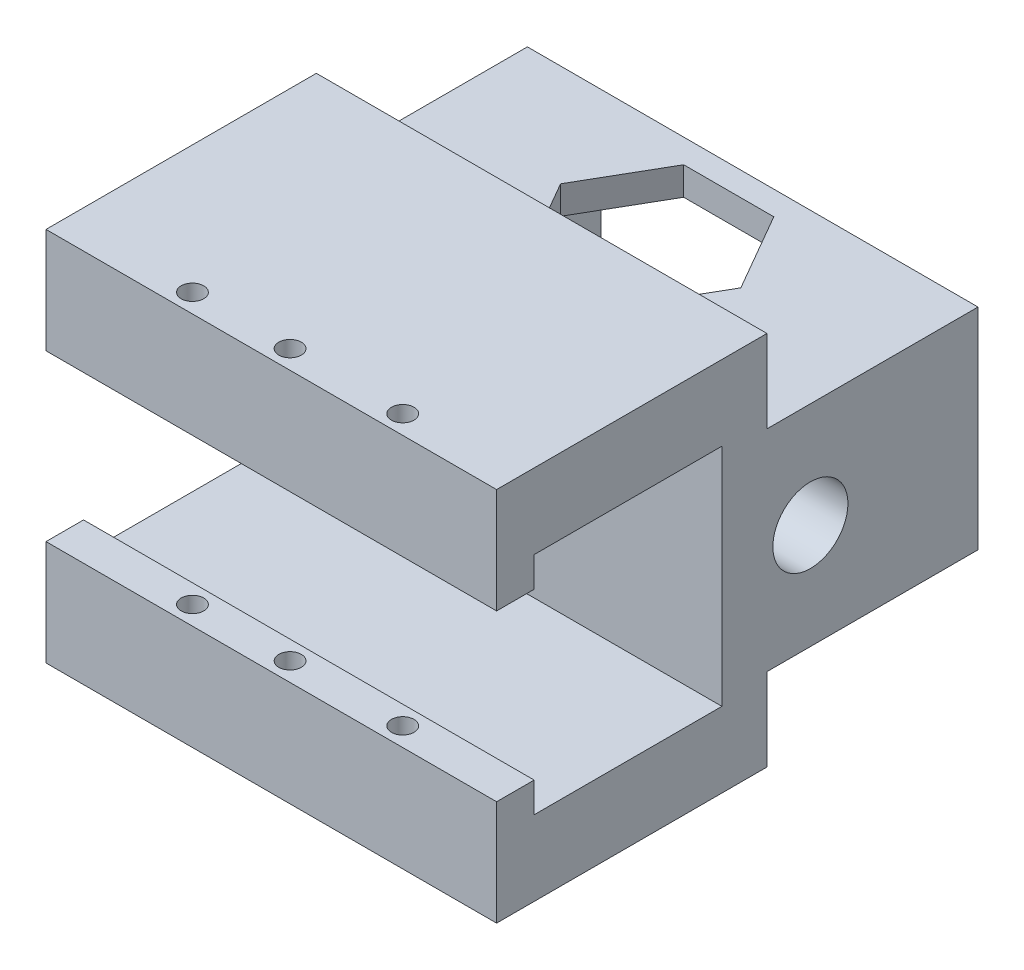
from build123d import *

# Parameters (mm, degrees)
SKETCH_1_W          = 60
SKETCH_1_H          = 50
EXTRUDE_1_DEPTH     = 6
SKETCH_2_W          = 60
SKETCH_2_H          = 10
EXTRUDE_3_DEPTH     = 30
SKETCH_3_W          = 60
SKETCH_3_H          = 5
EXTRUDE_4_DEPTH     = 4
SKETCH_4_W          = 60
SKETCH_4_H          = 5
EXTRUDE_5_DEPTH     = 4
SKETCH_9_W          = 60
SKETCH_9_H          = 28
SKETCH_9_W_2        = 40.4
SKETCH_9_H_2        = 20.5
EXTRUDE_6_DEPTH     = 28.1
SKETCH_11_R         = 5
CUT_EXTRUDE_3_DEPTH = 10
SKETCH_12_R         = 2.25
CUT_EXTRUDE_4_DEPTH = 16
CUT_EXTRUDE_5_DEPTH = 61.967204299
SKETCH_15_R         = 1.5
CUT_EXTRUDE_6_DEPTH = 60.093146811
SKETCH_16_R         = 1.5
CUT_EXTRUDE_7_DEPTH = 60.093146811


with BuildPart() as part:
    # 草图1 → 凸台-拉伸1 (new body)
    with BuildSketch(Plane.XY):
        Rectangle(SKETCH_1_W, SKETCH_1_H)
    extrude(amount=EXTRUDE_1_DEPTH)

    # 草图2 → 凸台-拉伸3 (add)
    with BuildSketch(Plane.XY.offset(6)):
        with Locations((0, 20)):
            Rectangle(SKETCH_2_W, SKETCH_2_H)
        with Locations((0, -20)):
            Rectangle(SKETCH_2_W, SKETCH_2_H)
    extrude(amount=EXTRUDE_3_DEPTH)

    # 草图3 → 凸台-拉伸4 (add)
    with BuildSketch(Plane(origin=(0, -15, 0), x_dir=(1, 0, 0), z_dir=(0, 1, 0))):
        with Locations((0, -33.5)):
            Rectangle(SKETCH_3_W, SKETCH_3_H)
    extrude(amount=EXTRUDE_4_DEPTH)

    # 草图4 → 凸台-拉伸5 (add)
    with BuildSketch(Plane.XZ.offset(-15)):
        with Locations((0, 33.5)):
            Rectangle(SKETCH_4_W, SKETCH_4_H)
    extrude(amount=EXTRUDE_5_DEPTH)

    # 草图9 → 凸台-拉伸6 (add)
    with BuildSketch(Plane(origin=(0, 0, 0), x_dir=(-1, 0, 0), z_dir=(0, 0, -1))):
        Rectangle(SKETCH_9_W, SKETCH_9_H)
        Rectangle(SKETCH_9_W_2, SKETCH_9_H_2, mode=Mode.SUBTRACT)
    extrude(amount=EXTRUDE_6_DEPTH)

    # 草图11 → 切除-拉伸3 (cut)
    with BuildSketch(Plane(origin=(30, 0, 0), x_dir=(0, 0, -1), z_dir=(1, 0, 0))):
        with Locations((5.781700187, 0)):
            Circle(SKETCH_11_R)
    extrude(amount=-CUT_EXTRUDE_3_DEPTH, mode=Mode.SUBTRACT)

    # 草图12 → 切除-拉伸4 (cut)
    with BuildSketch(Plane(origin=(0, 0, -28.1), x_dir=(-1, 0, 0), z_dir=(0, 0, -1))):
        with Locations((24.8, -5)):
            Circle(SKETCH_12_R)
        with Locations((24.8, 5)):
            Circle(SKETCH_12_R)
        with Locations((-24.8, -5)):
            Circle(SKETCH_12_R)
        with Locations((-24.8, 5)):
            Circle(SKETCH_12_R)
    extrude(amount=-CUT_EXTRUDE_4_DEPTH, mode=Mode.SUBTRACT)

    # 草图13 → 切除-拉伸5 (cut, through all)
    with BuildSketch(Plane(origin=(0, 14, 0), x_dir=(1, 0, 0), z_dir=(0, 1, 0))):
        Polygon((-12, 14.518770095), (-6, 4.12646525), (6, 4.12646525), (12, 14.518770095), (6, 24.911074941), (-6, 24.911074941), align=None)
    extrude(amount=-CUT_EXTRUDE_5_DEPTH, mode=Mode.SUBTRACT)

    # 草图15 → 切除-拉伸6 (cut, through all)
    with BuildSketch(Plane(origin=(0, -11, 0), x_dir=(1, 0, 0), z_dir=(0, 1, 0))):
        with Locations((15, -33.5)):
            Circle(SKETCH_15_R)
        with Locations((0, -33.5)):
            Circle(SKETCH_15_R)
        with Locations((-13, -33.5)):
            Circle(SKETCH_15_R)
    extrude(amount=-CUT_EXTRUDE_6_DEPTH, mode=Mode.SUBTRACT)

    # 草图16 → 切除-拉伸7 (cut, through all)
    with BuildSketch(Plane.XZ.offset(-11)):
        with Locations((-13, 33.5)):
            Circle(SKETCH_16_R)
        with Locations((0, 33.5)):
            Circle(SKETCH_16_R)
        with Locations((15, 33.5)):
            Circle(SKETCH_16_R)
    extrude(amount=-CUT_EXTRUDE_7_DEPTH, mode=Mode.SUBTRACT)


solid = part.part
